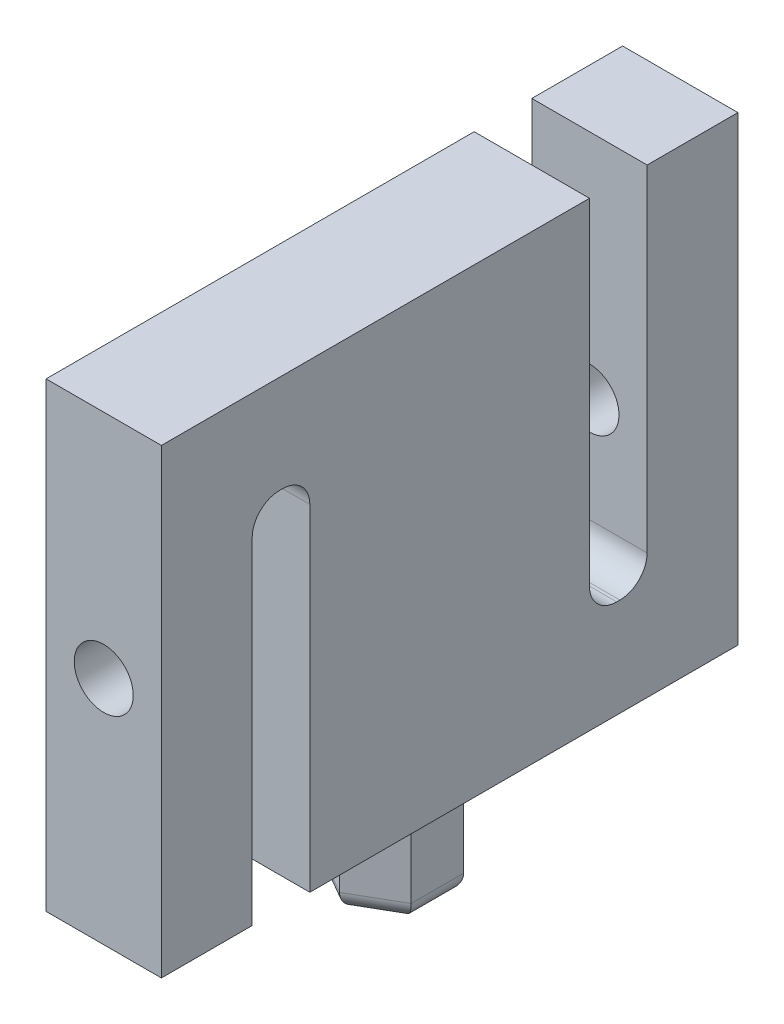
from build123d import *

# Parameters (mm, degrees)
BOSS_EXTRUDE1_DEPTH = 6.35
FILLET1_R           = 3
CUT_EXTRUDE1_REACH  = 313.409
SKETCH2_R           = 3.25
BOSS_EXTRUDE2_DEPTH = 10
FILLET2_R           = 2


with BuildPart() as part:
    # Sketch1 → Boss-Extrude1 (new, symmetric)
    with BuildSketch(Plane(origin=(0, 0, 0), x_dir=(0, 0, -1), z_dir=(1, 0, 0))):
        Polygon((-54.45, 304.8), (-54.45, 264.8), (-60.8, 264.8), (-60.8, 304.8), (-107.95, 304.8), (-107.95, 254), (-97.95, 254), (-97.95, 294), (-91.6, 294), (-91.6, 254), (-44.45, 254), (-44.45, 304.8), align=None)
    extrude(amount=BOSS_EXTRUDE1_DEPTH, both=True)

    # Fillet1
    fillet1_edges = [part.edges().sort_by_distance(p)[0] for p in [
        (0, 264.8, 60.8),
        (0, 264.8, 54.45),
        (0, 294, 91.6),
        (0, 294, 97.95),
    ]]
    fillet(fillet1_edges, radius=FILLET1_R)

    # Sketch2 → Cut-Extrude1 (cut, up to next)
    with BuildSketch(Plane(origin=(0, 0, 44.45), x_dir=(-1, 0, 0), z_dir=(0, 0, -1)), mode=Mode.PRIVATE) as cut_extrude1_sk1:
        with Locations((0, 279.4)):
            Circle(SKETCH2_R)
    cut_extrude1_tool1 = extrude(cut_extrude1_sk1.sketch, amount=-CUT_EXTRUDE1_REACH, mode=Mode.PRIVATE) & part.part
    cut_extrude1 = cut_extrude1_tool1.solids().sort_by_distance((0, 279.4, 44.45))[0]
    add(cut_extrude1, mode=Mode.SUBTRACT)

    # Mirror2: Cut-Extrude1 across plane
    add(cut_extrude1.mirror(Plane(origin=(0, 0, 76.2), x_dir=(1, 0, 0), z_dir=(0, 0, -1))), mode=Mode.SUBTRACT)


with BuildPart() as body_2:
    # Sketch8 → Boss-Extrude2 (new body)
    with BuildSketch(Plane.XZ.offset(-254)):
        Polygon((5, 73.313248654), (5, 79.086751346), (0, 81.973502692), (-5, 79.086751346), (-5, 73.313248654), (0, 70.426497308), align=None)
    extrude(amount=BOSS_EXTRUDE2_DEPTH)

    # Fillet2
    fillet2_edges = [body_2.edges().sort_by_distance(p)[0] for p in [
        (-2.5, 244, 71.869872981),
        (-5, 244, 76.2),
        (-2.5, 244, 80.530127019),
        (2.5, 244, 80.530127019),
        (5, 244, 76.2),
        (2.5, 244, 71.869872981),
    ]]
    fillet(fillet2_edges, radius=FILLET2_R)


solid = Compound([part.part, body_2.part])
